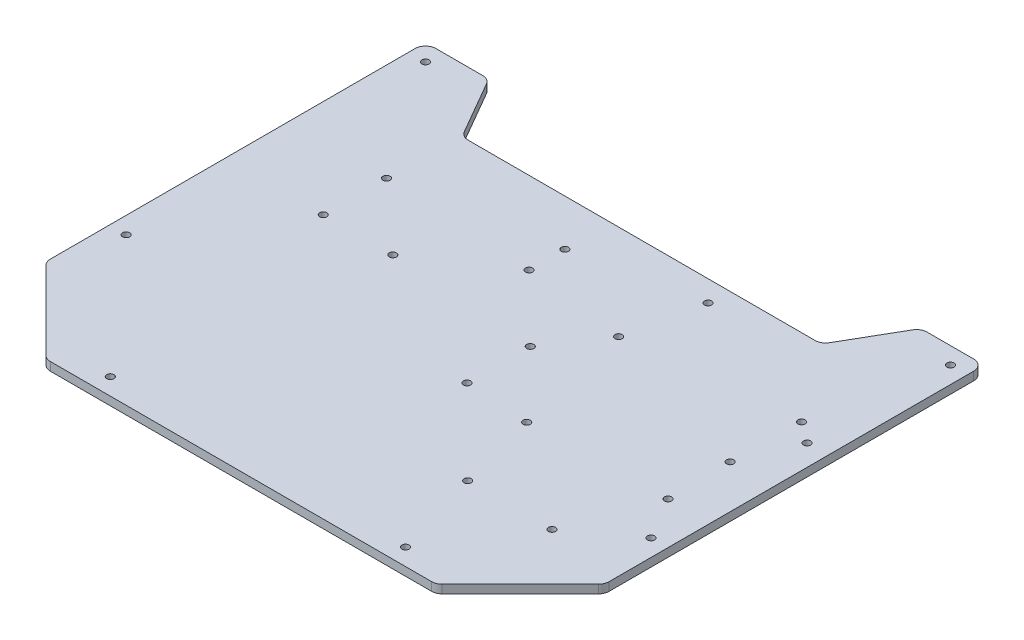
from build123d import *

# Parameters (mm, degrees)
MAIN_EXTRUSION_DEPTH    = 4
CONG_1_R                = 5
ESQUISSE1_R             = 1
ENL_V_MAT_EXTRU_1_DEPTH = 257.850637531
D_GAGEMENT_M31_D        = 3.4
ESQUISSE4_R             = 1
ENL_V_MAT_EXTRU_2_DEPTH = 257.850637531
D_GAGEMENT_M32_D        = 3.4


with BuildPart() as part:
    # Main scetch → Main extrusion (new body)
    with BuildSketch(Plane(origin=(0, 0, 0), x_dir=(1, 0, 0), z_dir=(0, 1, 0))):
        Polygon((-92.5, 0), (92.5, 0), (132.5, 40), (132.5, 220), (102.5, 220), (85.179491924, 190), (-85.179491924, 190), (-102.5, 220), (-132.5, 220), (-132.5, 40), align=None)
    extrude(amount=MAIN_EXTRUSION_DEPTH)

    # Congé1
    cong_1_edges = [part.edges().sort_by_distance(p)[0] for p in [
        (-132.5, 2, -40),
        (-92.5, 2, 0),
        (92.5, 2, 0),
        (132.5, 2, -40),
        (132.5, 2, -220),
        (102.5, 2, -220),
        (85.179491924, 2, -190),
        (-85.179491924, 2, -190),
        (-102.5, 2, -220),
        (-132.5, 2, -220),
    ]]
    fillet(cong_1_edges, radius=CONG_1_R)

    # Esquisse1 → Enlèv. mat.-Extru.1 (cut, through all)
    with BuildSketch(Plane(origin=(0, 4, 0), x_dir=(1, 0, 0), z_dir=(0, 1, 0))):
        with Locations((70, 8)):
            Circle(ESQUISSE1_R)
        with Locations((124.5, 70)):
            Circle(ESQUISSE1_R)
        with Locations((124.5, 212)):
            Circle(ESQUISSE1_R)
        with Locations((-124.5, 212)):
            Circle(ESQUISSE1_R)
        with Locations((-124.5, 70)):
            Circle(ESQUISSE1_R)
        with Locations((-70, 8)):
            Circle(ESQUISSE1_R)
    extrude(amount=-ENL_V_MAT_EXTRU_1_DEPTH, mode=Mode.SUBTRACT)

    # Dégagement M31 (through all)
    with Locations(Plane(origin=(0, 4, 0), x_dir=(1, 0, 0), z_dir=(0, 1, 0))):
        with Locations((-124.5, 212), (-124.5, 70), (-70, 8), (70, 8), (124.5, 70), (124.5, 212)):
            Hole(D_GAGEMENT_M31_D / 2)

    # Esquisse4 → Enlèv. mat.-Extru.2 (cut, through all)
    with BuildSketch(Plane(origin=(0, 4, 0), x_dir=(1, 0, 0), z_dir=(0, 1, 0))):
        with Locations((-86, 125)):
            Circle(ESQUISSE4_R)
        with Locations((-86, 155)):
            Circle(ESQUISSE4_R)
        with Locations((-53, 125)):
            Circle(ESQUISSE4_R)
        with Locations((-14.5, 151.1)):
            Circle(ESQUISSE4_R)
        with Locations((-14.5, 168.1)):
            Circle(ESQUISSE4_R)
        with Locations((41.5, 180)):
            Circle(ESQUISSE4_R)
        with Locations((34.12, 145)):
            Circle(ESQUISSE4_R)
        with Locations((112.5, 153.32)):
            Circle(ESQUISSE4_R)
        with Locations((122.5, 146)):
            Circle(ESQUISSE4_R)
        with Locations((112, 120)):
            Circle(ESQUISSE4_R)
        with Locations((112.5, 90)):
            Circle(ESQUISSE4_R)
        with Locations((17.2, 120)):
            Circle(ESQUISSE4_R)
        with Locations((17.2, 90)):
            Circle(ESQUISSE4_R)
        with Locations((47.5, 88)):
            Circle(ESQUISSE4_R)
        with Locations((57.5, 50)):
            Circle(ESQUISSE4_R)
        with Locations((97.5, 50)):
            Circle(ESQUISSE4_R)
    extrude(amount=-ENL_V_MAT_EXTRU_2_DEPTH, mode=Mode.SUBTRACT)

    # Dégagement M32 (through all)
    with Locations(Plane(origin=(0, 4, 0), x_dir=(1, 0, 0), z_dir=(0, 1, 0))):
        with Locations((-86, 155), (-86, 125), (-53, 125), (17.2, 120), (-14.5, 151.1), (-14.5, 168.1), (34.12, 145), (41.5, 180), (112.5, 153.32), (122.5, 146), (112, 120), (112.5, 90), (47.5, 88), (17.2, 90), (57.5, 50), (97.5, 50)):
            Hole(D_GAGEMENT_M32_D / 2)


solid = part.part
